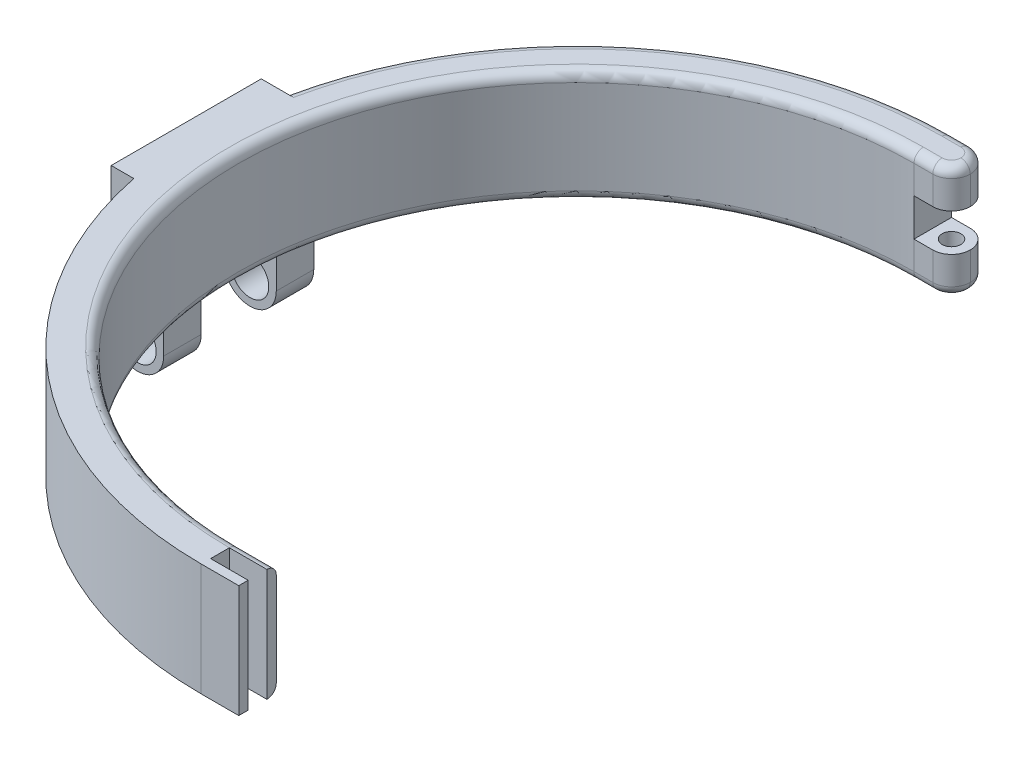
from build123d import *

# Parameters (mm, degrees)
BOSS_EXTRUDE1_DEPTH      = 30
BOSS_EXTRUDE2_DEPTH      = 14
BOSS_EXTRUDE2_DEPTH_BACK = 30
SKETCH2_W                = 14
SKETCH2_H                = 40
SKETCH3_W                = 14
SKETCH3_H                = 20
CUT_EXTRUDE1_DEPTH       = 14
CUT_EXTRUDE2_DEPTH       = 20
CUT_EXTRUDE2_DEPTH_BACK  = 20
SKETCH5_R                = 5
SKETCH6_W                = 10
SKETCH6_H                = 10
BOSS_EXTRUDE3_DEPTH      = 10
CUT_EXTRUDE3_DEPTH       = 15
CUT_EXTRUDE3_DEPTH_BACK  = 5
SKETCH7_R                = 2.5
SKETCH8_W                = 10
SKETCH8_H                = 30
BOSS_EXTRUDE4_DEPTH      = 10
SKETCH9_W                = 5
SKETCH9_H                = 30
CUT_EXTRUDE4_DEPTH       = 10
SKETCH10_R               = 10
CUT_EXTRUDE5_DEPTH       = 5
SKETCH11_R               = 12
CUT_EXTRUDE6_DEPTH       = 5
FILLET1_R                = 7
FILLET3_R                = 5
FILLET2_R                = 2.5


# Some blends are built 0.0001 mm under size
with BuildPart() as part:
    # Sketch1 → Boss-Extrude1 (new body)
    with BuildSketch(Plane(origin=(0, 0, 0), x_dir=(1, 0, 0), z_dir=(0, 1, 0))):
        with BuildLine():
            Line((0, 100), (0, 90))
            ThreePointArc((0, 90), (-90, 0), (0, -90))
            Line((0, -90), (0, -100))
            ThreePointArc((0, -100), (-100, 0), (0, 100))
        make_face()
    extrude(amount=BOSS_EXTRUDE1_DEPTH)

    # Sketch2 → Boss-Extrude2 (add, two sides: drawn at the far end of the back side and taken through both)
    with BuildSketch(Plane.XZ.offset(-BOSS_EXTRUDE2_DEPTH_BACK)):
        with Locations((-97, 0)):
            Rectangle(SKETCH2_W, SKETCH2_H)
    extrude(amount=BOSS_EXTRUDE2_DEPTH + BOSS_EXTRUDE2_DEPTH_BACK)

    # Sketch3 → Cut-Extrude1 (cut)
    with BuildSketch(Plane.XZ.offset(14)):
        with Locations((-97, 0)):
            Rectangle(SKETCH3_W, SKETCH3_H)
    extrude(amount=-CUT_EXTRUDE1_DEPTH, mode=Mode.SUBTRACT)

    # Sketch5 → Cut-Extrude2 (cut, two sides: drawn at the far end of the back side and taken through both)
    with BuildSketch(Plane.XY.offset(-CUT_EXTRUDE2_DEPTH_BACK)):
        with Locations((-97, -7)):
            Circle(SKETCH5_R)
    extrude(amount=CUT_EXTRUDE2_DEPTH + CUT_EXTRUDE2_DEPTH_BACK, mode=Mode.SUBTRACT)

    # Sketch6 → Boss-Extrude3 (add)
    with BuildSketch(Plane(origin=(0, 0, 0), x_dir=(0, 0, -1), z_dir=(1, 0, 0))):
        with Locations((95, 25)):
            Rectangle(SKETCH6_W, SKETCH6_H)
        with Locations((95, 5)):
            Rectangle(SKETCH6_W, SKETCH6_H)
    extrude(amount=BOSS_EXTRUDE3_DEPTH)

    # Sketch7 → Cut-Extrude3 (cut, two sides: drawn at the far end of the back side and taken through both)
    with BuildSketch(Plane(origin=(0, 10, 0), x_dir=(1, 0, 0), z_dir=(0, 1, 0)).offset(-CUT_EXTRUDE3_DEPTH_BACK)):
        with Locations(Location((5, 95, 0), (0, 0, 90))):
            Circle(SKETCH7_R)
    extrude(amount=CUT_EXTRUDE3_DEPTH + CUT_EXTRUDE3_DEPTH_BACK, mode=Mode.SUBTRACT)

    # Sketch8 → Boss-Extrude4 (add)
    with BuildSketch(Plane(origin=(0, 0, 0), x_dir=(0, 0, -1), z_dir=(1, 0, 0))):
        with Locations((-95, 15)):
            Rectangle(SKETCH8_W, SKETCH8_H)
    extrude(amount=BOSS_EXTRUDE4_DEPTH)

    # Sketch9 → Cut-Extrude4 (cut)
    with BuildSketch(Plane(origin=(10, 0, 0), x_dir=(0, 0, -1), z_dir=(1, 0, 0))):
        with Locations((-95, 15)):
            Rectangle(SKETCH9_W, SKETCH9_H)
    extrude(amount=-CUT_EXTRUDE4_DEPTH, mode=Mode.SUBTRACT)

    # Sketch10 → Cut-Extrude5 (cut)
    with BuildSketch(Plane.ZY.offset(104)):
        with Locations((0, 15)):
            Circle(SKETCH10_R)
    extrude(amount=-CUT_EXTRUDE5_DEPTH, mode=Mode.SUBTRACT)

    # Sketch11 → Cut-Extrude6 (cut)
    with BuildSketch(Plane.ZY.offset(99)):
        with Locations((0, 15)):
            Circle(SKETCH11_R)
    extrude(amount=-CUT_EXTRUDE6_DEPTH, mode=Mode.SUBTRACT)

    # Fillet1
    fillet1_edges = [part.edges().sort_by_distance(p)[0] for p in [
        (-104, -14, -15),
        (-90, -14, -15),
        (-104, -14, 15),
        (-90, -14, 15),
    ]]
    fillet(fillet1_edges, radius=FILLET1_R - 0.0001)  # a hair under: the kernel refuses the full size

    # Fillet3
    fillet3_edges = [part.edges().sort_by_distance(p)[0] for p in [
        (10, 5, -90),
        (10, 5, -100),
        (10, 25, -100),
        (10, 25, -90),
    ]]
    fillet(fillet3_edges, radius=FILLET3_R - 0.0001)  # a hair under: the kernel refuses the full size

    # Fillet2
    # the kernel refuses this fillet: 2.5 mm, written as the material it takes off along each edge
    with BuildSketch(Plane(origin=(0, 0, 90), x_dir=(0, 0, 1), z_dir=(1, 0, 0)), Plane(origin=(0, 30, 90), x_dir=(0, -1, 0), z_dir=(1, 0, 0))) as fillet2_piece_1:
        with BuildLine():
            CenterArc((FILLET2_R, -FILLET2_R), FILLET2_R, 90, 90)
            Line((0, -FILLET2_R), (0, 0))
            Line((0, 0), (FILLET2_R, 0))
        make_face()
    extrude(amount=16.25, mode=Mode.SUBTRACT)
    with BuildSketch(Plane(origin=(0, 0, -90), x_dir=(0, 0, -1), z_dir=(1, 0, 0)), Plane(origin=(0, 30, -90), x_dir=(0, -1, 0), z_dir=(1, 0, 0)), Plane(origin=(0, 30, -100), x_dir=(0, 0, 1), z_dir=(1, 0, 0))) as fillet2_piece_2:
        with BuildLine():
            CenterArc((FILLET2_R, FILLET2_R), FILLET2_R, 180, 90)
            Line((0, FILLET2_R), (0, 0))
            Line((0, 0), (FILLET2_R, 0))
        make_face()
    extrude(amount=5.0001, mode=Mode.SUBTRACT)
    with BuildSketch(Plane(origin=(0, 0, 0), x_dir=(0, 0, 1), z_dir=(1, 0, 0))) as fillet2_piece_3_section:
        with BuildLine():
            CenterArc((90 + FILLET2_R, -FILLET2_R), FILLET2_R, 90, 90)
            Line((90, -FILLET2_R), (90, 0))
            Line((90, 0), (90 + FILLET2_R, 0))
        make_face()
    fillet2_piece_3 = revolve(axis=Axis((0, 0, 0), (0, -1, 0)), revolution_arc=180, mode=Mode.PRIVATE)
    fillet2_piece_3 = split(fillet2_piece_3, bisect_by=Plane(origin=(-90, 0.417646948, 90.51789801), z_dir=(1, 0, 0)), keep=Keep.TOP, mode=Mode.PRIVATE)
    add(fillet2_piece_3, mode=Mode.SUBTRACT)
    with BuildSketch(Plane(origin=(0, 0, 0), x_dir=(0, 0, 1), z_dir=(1, 0, 0))) as fillet2_piece_4_section:
        with BuildLine():
            CenterArc((90 + FILLET2_R, -FILLET2_R), FILLET2_R, 90, 90)
            Line((90, -FILLET2_R), (90, 0))
            Line((90, 0), (90 + FILLET2_R, 0))
        make_face()
    fillet2_piece_4 = revolve(axis=Axis((0, 0, 0), (0, -1, 0)), revolution_arc=180, mode=Mode.PRIVATE)
    fillet2_piece_4 = split(fillet2_piece_4, bisect_by=Plane(origin=(-90.062527527, 0.003732432, 20), z_dir=(0, 0, 1)), keep=Keep.TOP, mode=Mode.PRIVATE)
    add(fillet2_piece_4, mode=Mode.SUBTRACT)
    with BuildSketch(Plane(origin=(0, 0, 0), x_dir=(0, 0, 1), z_dir=(1, 0, 0))) as fillet2_piece_5_section:
        with BuildLine():
            CenterArc((90 + FILLET2_R, -FILLET2_R), FILLET2_R, 90, 90)
            Line((90, -FILLET2_R), (90, 0))
            Line((90, 0), (90 + FILLET2_R, 0))
        make_face()
    fillet2_piece_5 = revolve(axis=Axis((0, 0, 0), (0, -1, 0)), revolution_arc=180, mode=Mode.PRIVATE)
    fillet2_piece_5 = split(fillet2_piece_5, bisect_by=Plane(origin=(-90.540406948, 0.460795961, -10), z_dir=(0, 0, 1)), keep=Keep.TOP, mode=Mode.PRIVATE)
    fillet2_piece_5 = split(fillet2_piece_5, bisect_by=Plane(origin=(-90.540406948, 0.460795961, 10), z_dir=(0, 0, -1)), keep=Keep.TOP, mode=Mode.PRIVATE)
    add(fillet2_piece_5, mode=Mode.SUBTRACT)
    with BuildSketch(Plane(origin=(0, 0, 0), x_dir=(0, 0, 1), z_dir=(1, 0, 0))) as fillet2_piece_6_section:
        with BuildLine():
            CenterArc((90 + FILLET2_R, -FILLET2_R), FILLET2_R, 90, 90)
            Line((90, -FILLET2_R), (90, 0))
            Line((90, 0), (90 + FILLET2_R, 0))
        make_face()
    fillet2_piece_6 = revolve(axis=Axis((0, 0, 0), (0, -1, 0)), revolution_arc=180, mode=Mode.PRIVATE)
    fillet2_piece_6 = split(fillet2_piece_6, bisect_by=Plane(origin=(-90.062527448, 0.003732432, -20), z_dir=(0, 0, -1)), keep=Keep.TOP, mode=Mode.PRIVATE)
    add(fillet2_piece_6, mode=Mode.SUBTRACT)
    with BuildSketch(Plane(origin=(0, 30, 0), x_dir=(0, 0, -1), z_dir=(1, 0, 0))) as fillet2_piece_7:
        with BuildLine():
            CenterArc((90 + FILLET2_R, -FILLET2_R), FILLET2_R, 90, 90)
            Line((90 + FILLET2_R, 0), (90, 0))
            Line((90, 0), (90, -FILLET2_R))
        make_face()
    revolve(axis=Axis((0, 30, 0), (0, 1, 0)), revolution_arc=180, mode=Mode.SUBTRACT)
    with BuildSketch(Plane(origin=(0, 0, 0), x_dir=(-0.9903773605712586, 0, -0.1383932211775821), z_dir=(-0.1383932211775821, 0, 0.9903773605712586))) as fillet2_piece_8_section:
        with BuildLine():
            CenterArc((100 - FILLET2_R, -FILLET2_R), FILLET2_R, 0, 90)
            Line((100, -FILLET2_R), (100, 0))
            Line((100, 0), (100 - FILLET2_R, 0))
        make_face()
    fillet2_piece_8 = revolve(axis=Axis((0, 0, 0), (0, -1, 0)), revolution_arc=82.045120461, mode=Mode.PRIVATE)
    fillet2_piece_8 = split(fillet2_piece_8, bisect_by=Plane(origin=(-62.807815321, 0.692124363, -20), z_dir=(0, 0, -1)), keep=Keep.TOP, mode=Mode.PRIVATE)
    add(fillet2_piece_8, mode=Mode.SUBTRACT)
    with BuildSketch(Plane(origin=(0, 0, -100), x_dir=(0, 0, 1), z_dir=(1, 0, 0))) as fillet2_piece_9:
        with BuildLine():
            CenterArc((FILLET2_R, -FILLET2_R), FILLET2_R, 90, 90)
            Line((0, -FILLET2_R), (0, 0))
            Line((0, 0), (FILLET2_R, 0))
        make_face()
    extrude(amount=5.0001, mode=Mode.SUBTRACT)
    with BuildSketch(Plane(origin=(5.0001, 0, -95.0001), x_dir=(1, 0, 0), z_dir=(0, 0, 1))) as fillet2_piece_10:
        with BuildLine():
            CenterArc((4.9999 - FILLET2_R, FILLET2_R), FILLET2_R, 270, 90)
            Line((4.9999, FILLET2_R), (4.9999, 0))
            Line((4.9999, 0), (4.9999 - FILLET2_R, 0))
        make_face()
    revolve(axis=Axis((5.0001, 0, -95.0001), (0, 1, 0)), revolution_arc=90, mode=Mode.SUBTRACT)
    with BuildSketch(Plane(origin=(5.0001, 0, -94.9999), x_dir=(0, 0, 1), z_dir=(-1, 0, 0))) as fillet2_piece_11:
        with BuildLine():
            CenterArc((4.9999 - FILLET2_R, FILLET2_R), FILLET2_R, 270, 90)
            Line((4.9999, FILLET2_R), (4.9999, 0))
            Line((4.9999, 0), (4.9999 - FILLET2_R, 0))
        make_face()
    revolve(axis=Axis((5.0001, 0, -94.9999), (0, 1, 0)), revolution_arc=90, mode=Mode.SUBTRACT)
    with BuildSketch(Plane(origin=(0, 30, 0), x_dir=(-0.9903773605712582, 0, -0.13839322117758568), z_dir=(-0.13839322117758568, 0, 0.9903773605712582))) as fillet2_piece_12_section:
        with BuildLine():
            CenterArc((100 - FILLET2_R, FILLET2_R), FILLET2_R, 270, 90)
            Line((100 - FILLET2_R, 0), (100, 0))
            Line((100, 0), (100, FILLET2_R))
        make_face()
    fillet2_piece_12 = revolve(axis=Axis((0, 30, 0), (0, -1, 0)), revolution_arc=82.045120461, mode=Mode.PRIVATE)
    fillet2_piece_12 = split(fillet2_piece_12, bisect_by=Plane(origin=(-62.807815321, 29.307875637, -20), z_dir=(0, 0, -1)), keep=Keep.TOP, mode=Mode.PRIVATE)
    add(fillet2_piece_12, mode=Mode.SUBTRACT)
    with BuildSketch(Plane(origin=(5.0001, 30, -95.0001), x_dir=(0, 0, -1), z_dir=(-1, 0, 0))) as fillet2_piece_13:
        with BuildLine():
            CenterArc((4.9999 - FILLET2_R, FILLET2_R), FILLET2_R, 270, 90)
            Line((4.9999, FILLET2_R), (4.9999, 0))
            Line((4.9999, 0), (4.9999 - FILLET2_R, 0))
        make_face()
    revolve(axis=Axis((5.0001, 30, -95.0001), (0, -1, 0)), revolution_arc=90, mode=Mode.SUBTRACT)
    with BuildSketch(Plane(origin=(5.0001, 30, -94.9999), x_dir=(0, 0, 1), z_dir=(-1, 0, 0))) as fillet2_piece_14:
        with BuildLine():
            CenterArc((4.9999 - FILLET2_R, -FILLET2_R), FILLET2_R, 0, 90)
            Line((4.9999, -FILLET2_R), (4.9999, 0))
            Line((4.9999, 0), (4.9999 - FILLET2_R, 0))
        make_face()
    revolve(axis=Axis((5.0001, 30, -94.9999), (0, 1, 0)), revolution_arc=90, mode=Mode.SUBTRACT)
    with BuildSketch(Plane(origin=(10, 30, -94.9999), x_dir=(-1, 0, 0), z_dir=(0, 0, -1)), Plane(origin=(10, 0, -95.0001), x_dir=(-1, 0, 0), z_dir=(0, 0, 1))) as fillet2_piece_15:
        with BuildLine():
            CenterArc((FILLET2_R, -FILLET2_R), FILLET2_R, 90, 90)
            Line((0, -FILLET2_R), (0, 0))
            Line((0, 0), (FILLET2_R, 0))
        make_face()
    extrude(amount=0.0002, mode=Mode.SUBTRACT)


solid = part.part
